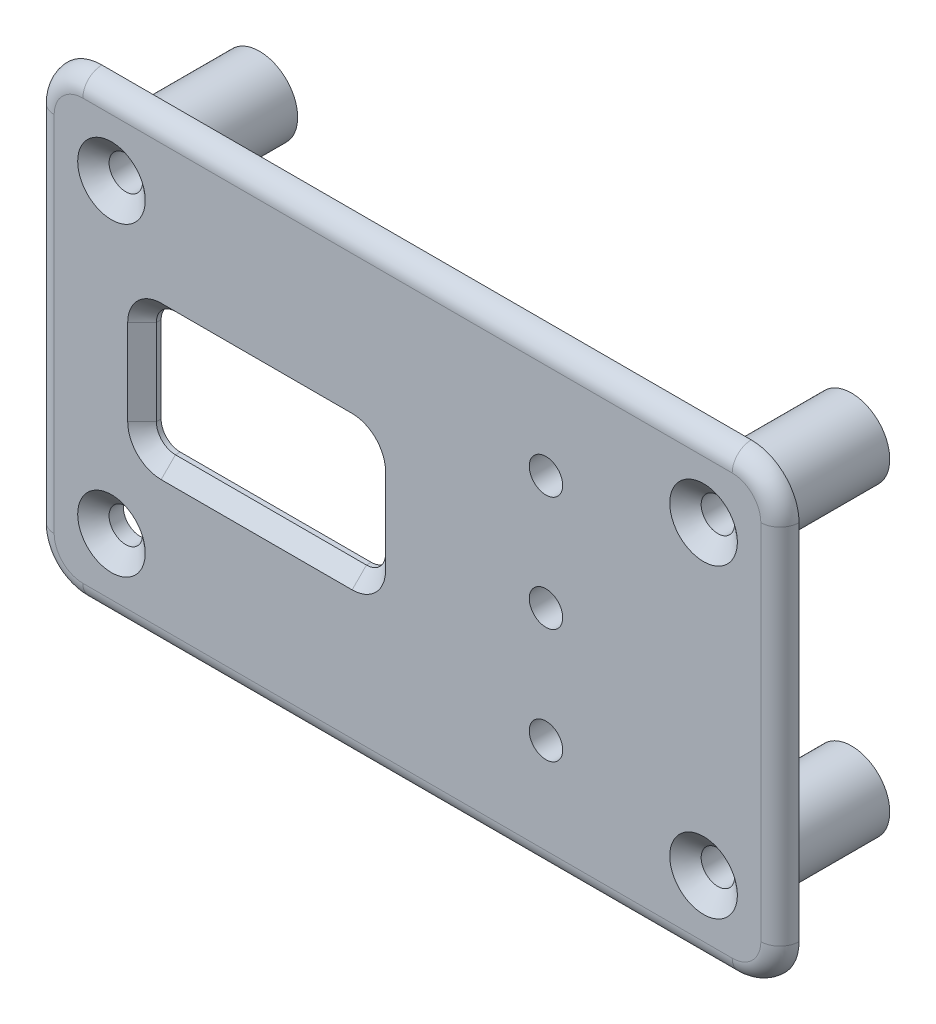
from build123d import *
from OCP.BRepFilletAPI import BRepFilletAPI_MakeChamfer

# Parameters (mm, degrees)
ESTRUSIONE_ESTRUSIONE1_DEPTH = 2
ESTRUSIONE_ESTRUSIONE2_DEPTH = 1
SCHIZZO3_R                   = 4
SCHIZZO3_R_2                 = 1.75
ESTRUSIONE_ESTRUSIONE3_DEPTH = 12.5
TAGLIO_ESTRUSIONE1_START     = -13
SCHIZZO4_R                   = 1.75
TAGLIO_ESTRUSIONE1_DEPTH     = 13
SCHIZZO5_W                   = 24
SCHIZZO5_H                   = 13
TAGLIO_ESTRUSIONE2_DEPTH     = 13
SCHIZZO6_W                   = 35
SCHIZZO6_H                   = 23
TAGLIO_ESTRUSIONE3_DEPTH     = 1
RACCORDO1_R                  = 2
RACCORDO2_R                  = 2
SMUSSO1_SIZE                 = 1.5
SMUSSO2_SIZE                 = 1.5
SMUSSO2_SIZE2                = 1.787630389
SCHIZZO7_R                   = 3.25
SCHIZZO7_R_2                 = 1.75
ESTRUSIONE_ESTRUSIONE4_DEPTH = 7
TAGLIO_ESTRUSIONE4_START     = -10
SCHIZZO8_R                   = 1.75
TAGLIO_ESTRUSIONE4_DEPTH     = 10


with BuildPart() as part:
    # Schizzo1 → Estrusione-Estrusione1 (new body)
    with BuildSketch(Plane.XY):
        with BuildLine():
            Line((-34, -24), (34, -24))
            ThreePointArc((34, -24), (37.535533906, -22.535533906), (39, -19))
            Line((39, -19), (39, 19))
            ThreePointArc((39, 19), (37.535533906, 22.535533906), (34, 24))
            Line((34, 24), (-34, 24))
            ThreePointArc((-34, 24), (-37.535533906, 22.535533906), (-39, 19))
            Line((-39, 19), (-39, -19))
            ThreePointArc((-39, -19), (-37.535533906, -22.535533906), (-34, -24))
        make_face()
    extrude(amount=ESTRUSIONE_ESTRUSIONE1_DEPTH)

    # Schizzo2 → Estrusione-Estrusione2 (add)
    with BuildSketch(Plane(origin=(0, 0, 0), x_dir=(-1, 0, 0), z_dir=(0, 0, -1))):
        with BuildLine():
            Line((-36.5, -18), (-36.5, 18))
            ThreePointArc((-36.5, 18), (-35.474873734, 20.474873734), (-33, 21.5))
            Line((-33, 21.5), (33, 21.5))
            ThreePointArc((33, 21.5), (35.474873734, 20.474873734), (36.5, 18))
            Line((36.5, 18), (36.5, -18))
            ThreePointArc((36.5, -18), (35.474873734, -20.474873734), (33, -21.5))
            Line((33, -21.5), (-33, -21.5))
            ThreePointArc((-33, -21.5), (-35.474873734, -20.474873734), (-36.5, -18))
        make_face()
    extrude(amount=ESTRUSIONE_ESTRUSIONE2_DEPTH)

    # Schizzo3 → Estrusione-Estrusione3 (add)
    # profile 1 of 3: a face of its own
    with BuildSketch(Plane(origin=(0, 0, -1), x_dir=(-1, 0, 0), z_dir=(0, 0, -1))):
        with Locations((-31, 16)):
            Circle(SCHIZZO3_R)
        with Locations((-31, 16)):
            Circle(SCHIZZO3_R_2, mode=Mode.SUBTRACT)
    # profile 2 of 3: a face of its own
    with BuildSketch(Plane(origin=(0, 0, -1), x_dir=(-1, 0, 0), z_dir=(0, 0, -1))):
        with Locations((-31, -16)):
            Circle(SCHIZZO3_R)
        with Locations((-31, -16)):
            Circle(SCHIZZO3_R_2, mode=Mode.SUBTRACT)
    # profile 3 of 3: a face of its own
    with BuildSketch(Plane(origin=(0, 0, -1), x_dir=(-1, 0, 0), z_dir=(0, 0, -1))):
        with Locations((31, 16)):
            Circle(SCHIZZO3_R)
        with Locations((31, 16)):
            Circle(SCHIZZO3_R_2, mode=Mode.SUBTRACT)
    extrude(amount=ESTRUSIONE_ESTRUSIONE3_DEPTH)

    # Schizzo4 → Taglio-Estrusione1 (cut)
    with BuildSketch(Plane(origin=(0, 0, -1), x_dir=(-1, 0, 0), z_dir=(0, 0, -1)).offset(TAGLIO_ESTRUSIONE1_START)):
        with Locations((-31, -16)):
            Circle(SCHIZZO4_R)
        with Locations((-31, 16)):
            Circle(SCHIZZO4_R)
        with Locations((31, 16)):
            Circle(SCHIZZO4_R)
        with Locations((31, -16)):
            Circle(SCHIZZO4_R)
    extrude(amount=TAGLIO_ESTRUSIONE1_DEPTH, mode=Mode.SUBTRACT)

    # Schizzo5 → Taglio-Estrusione2 (cut)
    with BuildSketch(Plane(origin=(0, 0, -1), x_dir=(-1, 0, 0), z_dir=(0, 0, -1))):
        with Locations((15.8, -0.5)):
            Rectangle(SCHIZZO5_W, SCHIZZO5_H)
    extrude(amount=-TAGLIO_ESTRUSIONE2_DEPTH, mode=Mode.SUBTRACT)

    # Schizzo6 → Taglio-Estrusione3 (cut)
    with BuildSketch(Plane(origin=(0, 0, -1), x_dir=(-1, 0, 0), z_dir=(0, 0, -1))):
        with Locations((15.8, -0.5)):
            Rectangle(SCHIZZO6_W, SCHIZZO6_H)
    extrude(amount=-TAGLIO_ESTRUSIONE3_DEPTH, mode=Mode.SUBTRACT)

    # Raccordo1
    raccordo1_edges = [part.edges().sort_by_distance(p)[0] for p in [
        (-37.535533906, 22.535533906, 2),
        (0, 24, 2),
        (37.535533906, 22.535533906, 2),
        (39, 0, 2),
        (37.535533906, -22.535533906, 2),
        (0, -24, 2),
        (-37.535533906, -22.535533906, 2),
        (-39, 0, 2),
    ]]
    fillet(raccordo1_edges, radius=RACCORDO1_R - 0.0001)  # a hair under: the kernel refuses the full size

    # Raccordo2
    raccordo2_edges = [part.edges().sort_by_distance(p)[0] for p in [
        (-3.8, -7, 1),
        (-3.8, 6, 1),
        (-27.8, 6, 1),
        (-27.8, -7, 1),
    ]]
    fillet(raccordo2_edges, radius=RACCORDO2_R)

    # Smusso1
    smusso1_edges = [part.edges().sort_by_distance(p)[0] for p in [
        (-27.8, -0.5, 2),
        (-15.8, -7, 2),
        (-3.8, -0.5, 2),
        (-15.8, 6, 2),
        (-27.214213562, -6.414213562, 2),
        (-4.385786438, -6.414213562, 2),
        (-4.385786438, 5.414213562, 2),
        (-27.214213562, 5.414213562, 2),
    ]]
    chamfer(smusso1_edges, length=SMUSSO1_SIZE)

    # Smusso2: one chamfer whose edges measure the first distance from different faces: ONE call of the kernel's chamfer builder (chamfer() names one face for all edges)
    smusso2_edges_1 = [part.edges().sort_by_distance(p)[0] for p in [
        (-29.25, -16, 2),
    ]]
    smusso2_side_1 = [part.faces().sort_by_distance(p)[0] for p in [
        (-29.25, -16, 0.5),
    ]]
    smusso2_edges_2 = [part.edges().sort_by_distance(p)[0] for p in [
        (-29.25, 16, 2),
    ]]
    smusso2_side_2 = [part.faces().sort_by_distance(p)[0] for p in [
        (-29.25, 16, -5.75),
    ]]
    smusso2_edges_3 = [part.edges().sort_by_distance(p)[0] for p in [
        (32.75, 16, 2),
    ]]
    smusso2_side_3 = [part.faces().sort_by_distance(p)[0] for p in [
        (32.75, 16, -5.75),
    ]]
    smusso2_edges_4 = [part.edges().sort_by_distance(p)[0] for p in [
        (32.75, -16, 2),
    ]]
    smusso2_side_4 = [part.faces().sort_by_distance(p)[0] for p in [
        (32.75, -16, -5.75),
    ]]
    smusso2 = BRepFilletAPI_MakeChamfer(part.part.solid().wrapped)
    for e in smusso2_edges_1:
        smusso2.Add(SMUSSO2_SIZE, SMUSSO2_SIZE2, e.wrapped, smusso2_side_1[0].wrapped)  # the first distance lies on this face
    for e in smusso2_edges_2:
        smusso2.Add(SMUSSO2_SIZE, SMUSSO2_SIZE2, e.wrapped, smusso2_side_2[0].wrapped)  # the first distance lies on this face
    for e in smusso2_edges_3:
        smusso2.Add(SMUSSO2_SIZE, SMUSSO2_SIZE2, e.wrapped, smusso2_side_3[0].wrapped)  # the first distance lies on this face
    for e in smusso2_edges_4:
        smusso2.Add(SMUSSO2_SIZE, SMUSSO2_SIZE2, e.wrapped, smusso2_side_4[0].wrapped)  # the first distance lies on this face
    add(Compound.cast(smusso2.Shape()), mode=Mode.REPLACE)

    # Schizzo7 → Estrusione-Estrusione4 (add)
    # profile 1 of 3: a face of its own
    with BuildSketch(Plane(origin=(0, 0, -1), x_dir=(-1, 0, 0), z_dir=(0, 0, -1))):
        with Locations((-14.5, 12)):
            Circle(SCHIZZO7_R)
        with Locations((-14.5, 12)):
            Circle(SCHIZZO7_R_2, mode=Mode.SUBTRACT)
    # profile 2 of 3: a face of its own
    with BuildSketch(Plane(origin=(0, 0, -1), x_dir=(-1, 0, 0), z_dir=(0, 0, -1))):
        with Locations((-14.5, 0)):
            Circle(SCHIZZO7_R)
        with Locations((-14.5, 0)):
            Circle(SCHIZZO7_R_2, mode=Mode.SUBTRACT)
    # profile 3 of 3: a face of its own
    with BuildSketch(Plane(origin=(0, 0, -1), x_dir=(-1, 0, 0), z_dir=(0, 0, -1))):
        with Locations((-14.5, -12)):
            Circle(SCHIZZO7_R)
        with Locations((-14.5, -12)):
            Circle(SCHIZZO7_R_2, mode=Mode.SUBTRACT)
    extrude(amount=ESTRUSIONE_ESTRUSIONE4_DEPTH)

    # Schizzo8 → Taglio-Estrusione4 (cut)
    with BuildSketch(Plane(origin=(0, 0, -1), x_dir=(-1, 0, 0), z_dir=(0, 0, -1)).offset(TAGLIO_ESTRUSIONE4_START)):
        with Locations((-14.5, 12)):
            Circle(SCHIZZO8_R)
        with Locations((-14.5, 0)):
            Circle(SCHIZZO8_R)
        with Locations((-14.5, -12)):
            Circle(SCHIZZO8_R)
    extrude(amount=TAGLIO_ESTRUSIONE4_DEPTH, mode=Mode.SUBTRACT)


solid = part.part
